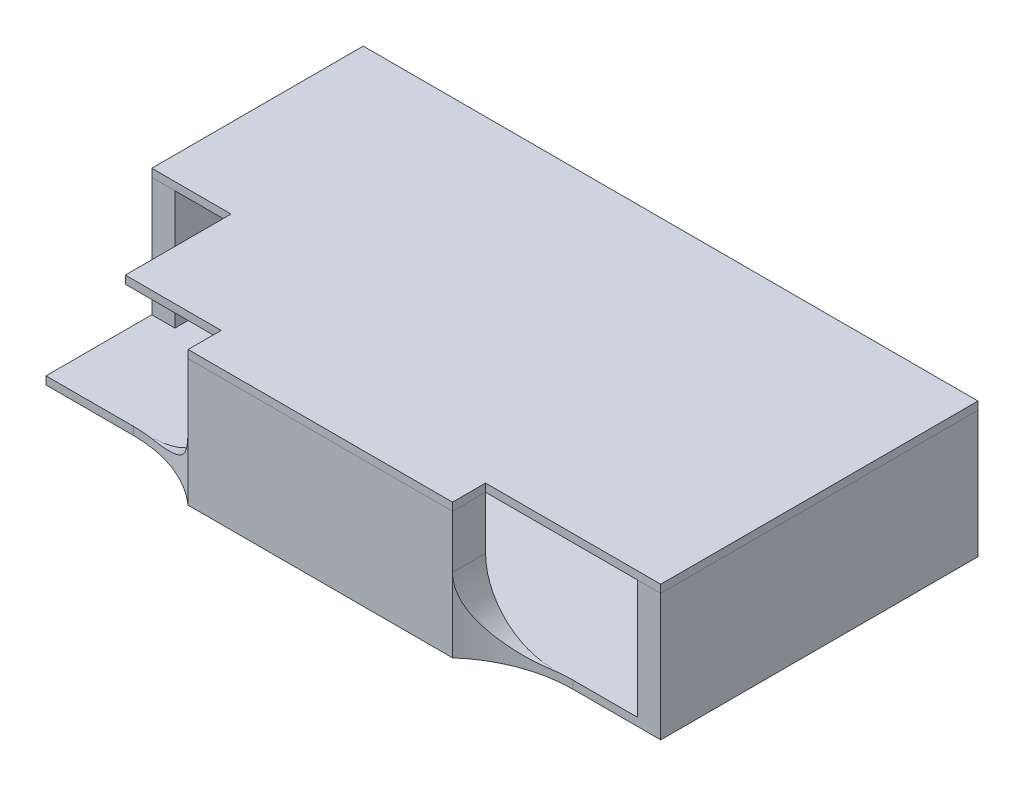
from build123d import *

# Parameters (mm, degrees)
SKETCH6_W            = 46.5
SKETCH6_H            = 24
BOSS_EXTRUDE4_DEPTH  = 0.6
SKETCH7_W            = 1.75
SKETCH7_H            = 24
SKETCH7_H_2          = 16
BOSS_EXTRUDE5_DEPTH  = 9
SKETCH8_W            = 20
SKETCH8_H            = 9.6
BOSS_EXTRUDE6_DEPTH  = 2.5
FILLET1_R            = 10
FILLET2_R            = 5
BOSS_EXTRUDE12_DEPTH = 0.6


with BuildPart() as part:
    # Sketch6 → Boss-Extrude4 (new body)
    with BuildSketch(Plane(origin=(0, 0, 0), x_dir=(1, 0, 0), z_dir=(0, 1, 0))):
        Rectangle(SKETCH6_W, SKETCH6_H)
    extrude(amount=BOSS_EXTRUDE4_DEPTH)

    # Sketch7 → Boss-Extrude5 (add)
    with BuildSketch(Plane(origin=(0, 0.6, 0), x_dir=(1, 0, 0), z_dir=(0, 1, 0))):
        with Locations((22.375, 0)):
            Rectangle(SKETCH7_W, SKETCH7_H)
        with Locations((-22.375, 4)):
            Rectangle(SKETCH7_W, SKETCH7_H_2)
    extrude(amount=BOSS_EXTRUDE5_DEPTH)

    # Sketch8 → Boss-Extrude6 (add)
    with BuildSketch(Plane.XY.offset(12)):
        with Locations((0, 4.8)):
            Rectangle(SKETCH8_W, SKETCH8_H)
    extrude(amount=BOSS_EXTRUDE6_DEPTH)

    # Fillet1
    # the kernel refuses this fillet: 10 mm, written as the material it adds along each edge
    with BuildSketch(Plane(origin=(-10, 0.6, 12), x_dir=(-1, 0, 0), z_dir=(0, -1, 0)), Plane(origin=(10, 0, 12), x_dir=(1, 0, 0), z_dir=(0, 1, 0))) as fillet1_piece_1:
        with BuildLine():
            CenterArc((6.614378278, -10), FILLET1_R, 90, 41.409622109)
            Line((0, -2.5), (0, 0))
            Line((0, 0), (6.614378278, 0))
        make_face()
    extrude(amount=0.6)

    # Fillet2
    # the kernel refuses this fillet: 5 mm, written as the material it adds along each edge
    with BuildSketch(Plane(origin=(-10, 0.6, 27), x_dir=(-1, 0, 0), z_dir=(0, 0, -1))) as fillet2_piece_1_section:
        with BuildLine():
            CenterArc((FILLET2_R, FILLET2_R), FILLET2_R, 180, 90)
            Line((0, FILLET2_R), (0, 0))
            Line((0, 0), (FILLET2_R, 0))
        make_face()
    fillet2_piece_1 = extrude(amount=15, mode=Mode.PRIVATE)
    fillet2_piece_1 = fillet2_piece_1 - Plane(origin=(-16.614378278, 1.904105076, 22), x_dir=(-1, 0, 0), z_dir=(0, 1, 0)) * Cylinder(10, 50, mode=Mode.PRIVATE)
    add(fillet2_piece_1)
    with BuildSketch(Plane(origin=(10, 0.6, 27), x_dir=(1, 0, 0), z_dir=(0, 0, -1))) as fillet2_piece_2_section:
        with BuildLine():
            CenterArc((FILLET2_R, -FILLET2_R), FILLET2_R, 90, 90)
            Line((0, -FILLET2_R), (0, 0))
            Line((0, 0), (FILLET2_R, 0))
        make_face()
    fillet2_piece_2 = extrude(amount=15, mode=Mode.PRIVATE)
    fillet2_piece_2 = fillet2_piece_2 - Plane(origin=(16.614378278, 1.904105076, 22), x_dir=(1, 0, 0), z_dir=(0, -1, 0)) * Cylinder(10, 50, mode=Mode.PRIVATE)
    add(fillet2_piece_2)


with BuildPart() as body_2:
    # Sketch10 → Boss-Extrude12 (new body)
    with BuildSketch(Plane(origin=(0, 9.6, 0), x_dir=(1, 0, 0), z_dir=(0, 1, 0))):
        Polygon((-23.25, 12), (23.25, 12), (23.25, -12), (10, -12), (10, -14.5), (-10, -14.5), (-10, -12), (-17.25, -12), (-17.25, -4), (-23.25, -4), align=None)
    extrude(amount=BOSS_EXTRUDE12_DEPTH)


solid = Compound([part.part, body_2.part])
